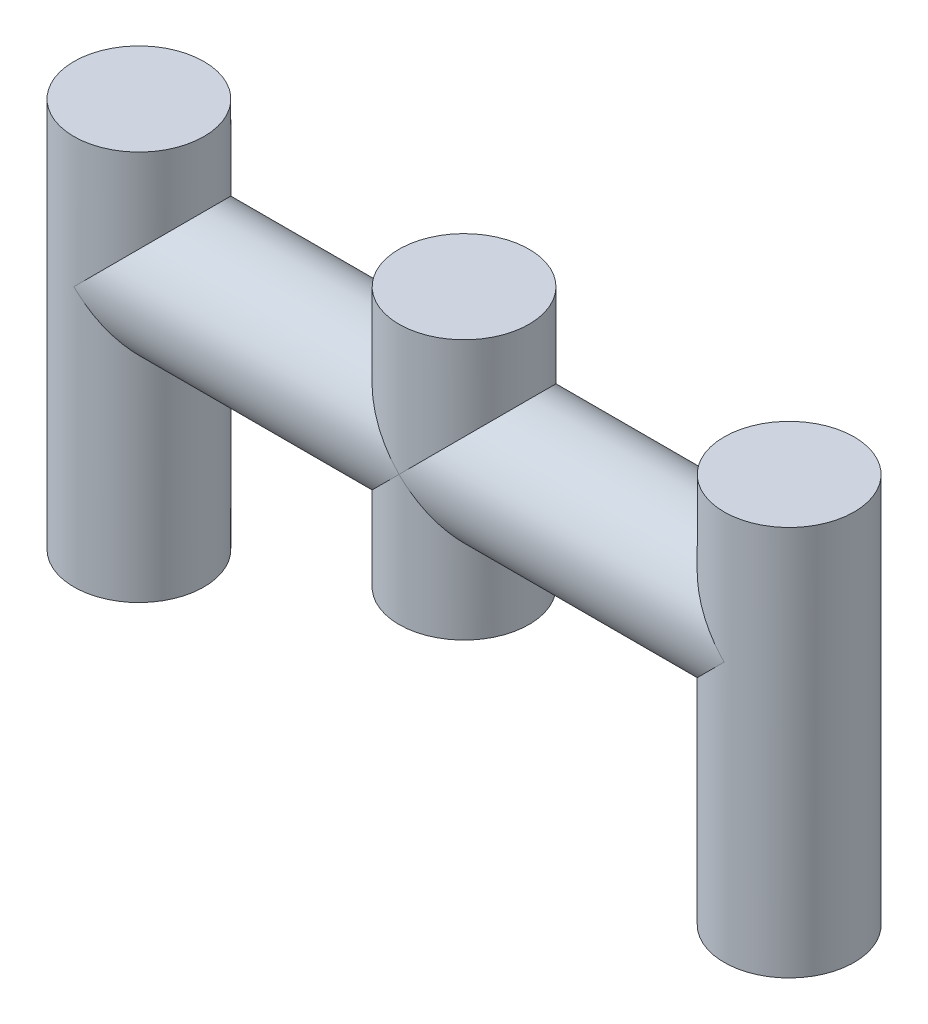
from build123d import *

# Parameters (mm, degrees)
SKETCH2_R           = 2.5
BOSS_EXTRUDE2_DEPTH = 10
SKETCH3_R           = 2.5
BOSS_EXTRUDE3_DEPTH = 12.5
BOSS_EXTRUDE4_DEPTH = 10
BOSS_EXTRUDE5_START = 5
SKETCH5_R           = 2.5
BOSS_EXTRUDE5_DEPTH = 5


with BuildPart() as part:
    # Sketch2 → Boss-Extrude2 (new body)
    with BuildSketch(Plane(origin=(0, 0, 0), x_dir=(1, 0, 0), z_dir=(0, 1, 0))):
        Circle(SKETCH2_R)
    boss_extrude2 = extrude(amount=BOSS_EXTRUDE2_DEPTH)

    # Sketch3 → Boss-Extrude3 (add)
    with BuildSketch(Plane(origin=(0, 0, 0), x_dir=(0, 0, -1), z_dir=(1, 0, 0))):
        with Locations((0, 5)):
            Circle(SKETCH3_R)
    boss_extrude3 = extrude(amount=BOSS_EXTRUDE3_DEPTH)

    # Sketch4 → Boss-Extrude4 (add)
    with BuildSketch(Plane(origin=(0, 0, 0), x_dir=(1, 0, 0), z_dir=(0, 1, 0))):
        with BuildLine():
            Line((12.5, 2.5), (12.5, -2.5))
            ThreePointArc((12.5, -2.5), (10, 0), (12.5, 2.5))
        make_face()
    boss_extrude4 = extrude(amount=BOSS_EXTRUDE4_DEPTH)

    # Mirror5: Boss-Extrude2, Boss-Extrude3, Boss-Extrude4 across plane
    add(boss_extrude2.mirror(Plane(origin=(12.5, 5, 0), x_dir=(0, 0, 1), z_dir=(1, 0, 0))))
    add(boss_extrude3.mirror(Plane(origin=(12.5, 5, 0), x_dir=(0, 0, 1), z_dir=(1, 0, 0))))
    add(boss_extrude4.mirror(Plane(origin=(12.5, 5, 0), x_dir=(0, 0, 1), z_dir=(1, 0, 0))))

    # Sketch5 → Boss-Extrude5 (add)
    with BuildSketch(Plane.XZ.offset(BOSS_EXTRUDE5_START)):
        Circle(SKETCH5_R)
        with Locations((25, 0)):
            Circle(SKETCH5_R)
    extrude(amount=-BOSS_EXTRUDE5_DEPTH)


solid = part.part
